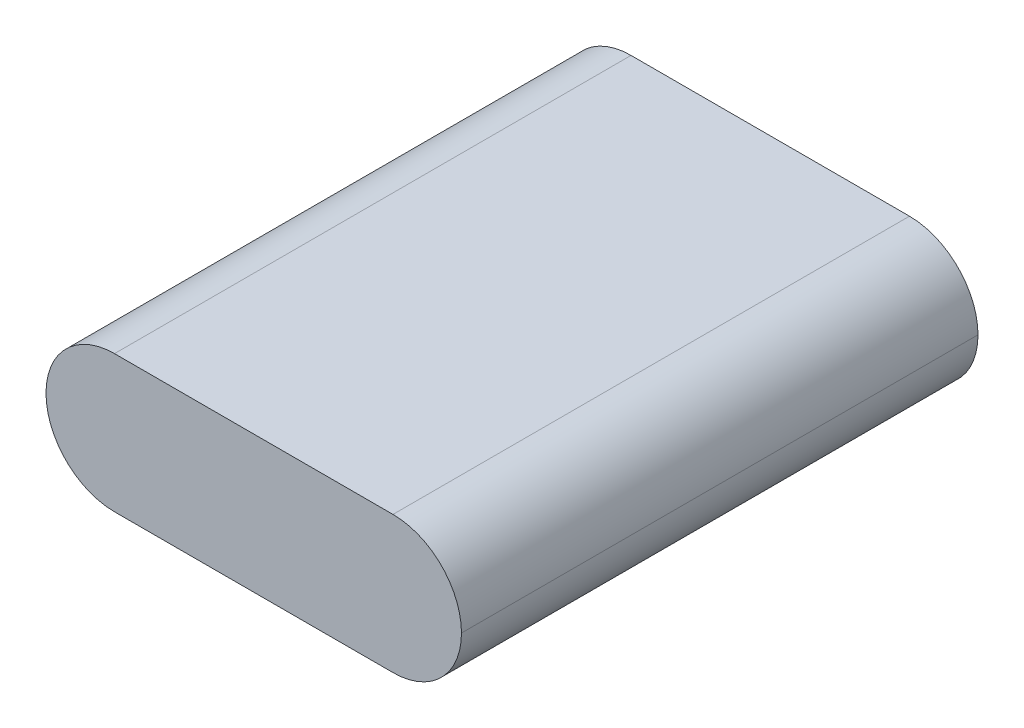
from build123d import *

# Parameters (mm, degrees)
SKETCH1_W           = 55.5
SKETCH1_H           = 69
BOSS_EXTRUDE1_DEPTH = 9.15
FILLET1_R           = 9.15


with BuildPart() as part:
    # Sketch1 → Boss-Extrude1 (new, symmetric)
    with BuildSketch(Plane(origin=(0, 0, 0), x_dir=(1, 0, 0), z_dir=(0, 1, 0))):
        Rectangle(SKETCH1_W, SKETCH1_H)
    extrude(amount=BOSS_EXTRUDE1_DEPTH, both=True)

    # Fillet1
    fillet1_edges = [part.edges().sort_by_distance(p)[0] for p in [
        (27.75, -9.15, 0),
        (27.75, 9.15, 0),
        (-27.75, -9.15, 0),
        (-27.75, 9.15, 0),
    ]]
    fillet(fillet1_edges, radius=FILLET1_R - 0.0001)  # a hair under: the kernel refuses the full size


solid = part.part
